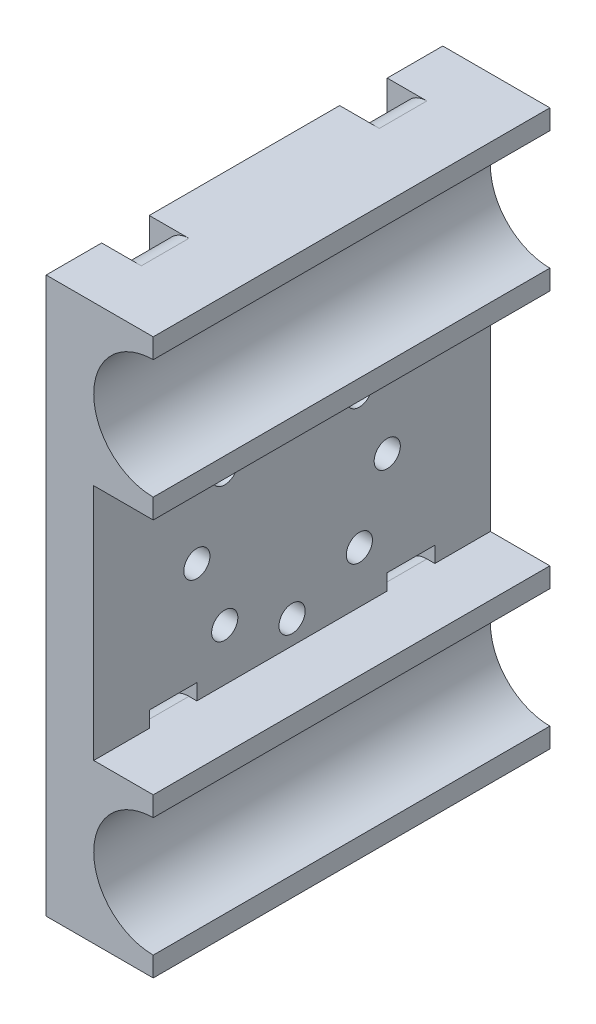
from build123d import *

# Parameters (mm, degrees)
RESSALTO_EXTRUS_O1_DEPTH = 50
ESBO_O2_R                = 1.65
ESBO_O2_W                = 6
ESBO_O2_H                = 2
CORTE_EXTRUS_O1_DEPTH    = 10
ESBO_O3_W                = 6
ESBO_O3_H                = 20
CORTE_EXTRUS_O2_DEPTH    = 2
FILETE1_R                = 3


with BuildPart() as part:
    # Esboço1 → Ressalto-extrusão1 (new body)
    with BuildSketch(Plane.XY):
        with BuildLine():
            Line((0, 35), (0, -35))
            Line((0, -35), (13.5, -35))
            Line((13.5, -35), (13.5, -32.5))
            ThreePointArc((13.5, -32.5), (6, -25), (13.5, -17.5))
            Line((13.5, -17.5), (13.5, -15))
            Line((13.5, -15), (6, -15))
            Line((6, -15), (6, 15))
            Line((6, 15), (13.5, 15))
            Line((13.5, 15), (13.5, 17.5))
            ThreePointArc((13.5, 17.5), (6, 25), (13.5, 32.5))
            Line((13.5, 32.5), (13.5, 35))
            Line((13.5, 35), (0, 35))
        make_face()
    extrude(amount=RESSALTO_EXTRUS_O1_DEPTH)

    # Esboço2 → Corte-extrusão1 (cut)
    with BuildSketch(Plane(origin=(6, 0, 0), x_dir=(0, 0, -1), z_dir=(1, 0, 0))):
        with Locations((-25, 12)):
            Circle(ESBO_O2_R)
        with Locations((-16.514718626, 8.485281374)):
            Circle(ESBO_O2_R)
        with Locations((-13, 0)):
            Circle(ESBO_O2_R)
        with Locations((-16.514718626, -8.485281374)):
            Circle(ESBO_O2_R)
        with Locations((-25, -12)):
            Circle(ESBO_O2_R)
        with Locations((-33.485281374, -8.485281374)):
            Circle(ESBO_O2_R)
        with Locations((-37, 0)):
            Circle(ESBO_O2_R)
        with Locations((-33.485281374, 8.485281374)):
            Circle(ESBO_O2_R)
        with Locations((-10, 14)):
            Rectangle(ESBO_O2_W, ESBO_O2_H)
        with Locations((-40, 14)):
            Rectangle(ESBO_O2_W, ESBO_O2_H)
        with Locations((-40, -14)):
            Rectangle(ESBO_O2_W, ESBO_O2_H)
        with Locations((-10, -14)):
            Rectangle(ESBO_O2_W, ESBO_O2_H)
    extrude(amount=-CORTE_EXTRUS_O1_DEPTH, mode=Mode.SUBTRACT)

    # Esboço3 → Corte-extrusão2 (cut)
    with BuildSketch(Plane.ZY):
        with Locations((10, 25)):
            Rectangle(ESBO_O3_W, ESBO_O3_H)
        with Locations((40, 25)):
            Rectangle(ESBO_O3_W, ESBO_O3_H)
        with Locations((40, -25)):
            Rectangle(ESBO_O3_W, ESBO_O3_H)
        with Locations((10, -25)):
            Rectangle(ESBO_O3_W, ESBO_O3_H)
    extrude(amount=-CORTE_EXTRUS_O2_DEPTH, mode=Mode.SUBTRACT)

    # Filete1
    filete1_edges = [part.edges().sort_by_distance(p)[0] for p in [
        (2, -35, 10),
        (2, -35, 40),
        (2, 35, 40),
        (2, 35, 10),
        (2, -15, 10),
        (2, -15, 40),
        (2, 15, 40),
        (2, 15, 10),
    ]]
    fillet(filete1_edges, radius=FILETE1_R)


solid = part.part
